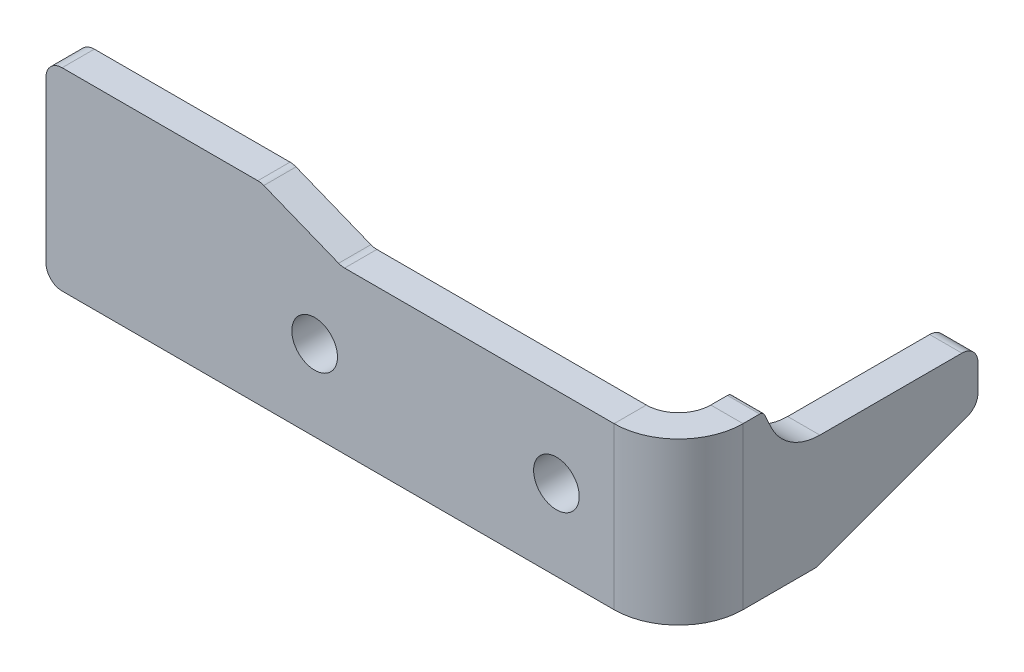
from build123d import *

# Parameters (mm, degrees)
SKETCH1_R                = 4.25
EXTRUDE1_DEPTH           = 6
PROCESS_BENDS1_START     = -45.500357344
PROCESS_BENDS1_OUTLINE_W = 30
PROCESS_BENDS1_OUTLINE_H = 6
PROCESS_BENDS1_DEPTH     = 45.500357344
PROCESS_BENDS1_START_2   = -50.267477344
PROCESS_BENDS1_2_DEPTH   = 4.83288
PROCESS_BENDS1_START_3   = -56.267477344
PROCESS_BENDS1_3_DEPTH   = 6
PROCESS_BENDS1_START_4   = -45.434597344
PROCESS_BENDS1_4_DEPTH   = 1.16712
PROCESS_BENDS1_START_5   = -21
PROCESS_BENDS1_5_DEPTH   = 30


with BuildPart() as part:
    # Sketch1 → Extrude1 (new body)
    with BuildSketch(Plane.XY):
        with BuildLine():
            Line((-106.422252789, 9), (-40.637070261, 9))
            ThreePointArc((-40.637070261, 9), (-40.099770652, 8.843391446), (-39.730762474, 8.422618262))
            Line((-39.730762474, 8.422618262), (-38.495606339, 5.773817383))
            ThreePointArc((-38.495606339, 5.773817383), (-34.805524552, 1.566085542), (-29.432528469, 0))
            Line((-29.432528469, 0), (-3, 0))
            ThreePointArc((-3, 0), (-0.878679656, -0.878679656), (0, -3))
            Line((0, -3), (0, -7.904690938))
            ThreePointArc((0, -7.904690938), (-0.540498847, -9.622495956), (-1.967236053, -10.721319886))
            Line((-1.967236053, -10.721319886), (-29.49989713, -20.816628948))
            ThreePointArc((-29.49989713, -20.816628948), (-30.008202711, -20.95380152), (-30.532661077, -21))
            Line((-30.532661077, -21), (-159, -21))
            ThreePointArc((-159, -21), (-161.121320344, -20.121320344), (-162, -18))
            Line((-162, -18), (-162, 12))
            ThreePointArc((-162, 12), (-161.121320344, 14.121320344), (-159, 15))
            Line((-159, 15), (-122.577747211, 15))
            ThreePointArc((-122.577747211, 15), (-122.010424647, 14.94586916), (-121.463575182, 14.785430073))
            Line((-121.463575182, 14.785430073), (-107.536424818, 9.214569927))
            ThreePointArc((-107.536424818, 9.214569927), (-106.989575353, 9.05413084), (-106.422252789, 9))
        make_face()
        with Locations((-67, -6)):
            Circle(SKETCH1_R, mode=Mode.SUBTRACT)
        with Locations((-112, -6)):
            Circle(SKETCH1_R, mode=Mode.SUBTRACT)
    extrude(amount=EXTRUDE1_DEPTH)

    # Process-Bends1: read off the stored shape, not the designer's step
    # Process-Bends1 outline → Process-Bends1 (cut)
    with BuildSketch(Plane.YZ.offset(PROCESS_BENDS1_START)):
        with Locations((-6, 3)):
            Rectangle(PROCESS_BENDS1_OUTLINE_W, PROCESS_BENDS1_OUTLINE_H)
    extrude(amount=PROCESS_BENDS1_DEPTH, mode=Mode.SUBTRACT)

    # Process-Bends1 2 outline → Process-Bends1 2 (add)
    with BuildSketch(Plane.YZ.offset(PROCESS_BENDS1_START_2)):
        with BuildLine():
            Line((5.773817383, -11.236916317), (8.422618262, -10.001760182))
            ThreePointArc((8.422618262, -10.001760182), (8.843391446, -9.632752004), (9, -9.095452395))
            Line((9, -9.095452395), (9, 0))
            Line((9, 0), (-21, 0))
            Line((-21, 0), (-21, -19.199861579))
            ThreePointArc((-21, -19.199861579), (-20.95380152, -19.724319945), (-20.816628948, -20.232625526))
            Line((-20.816628948, -20.232625526), (-10.721319886, -47.765286604))
            ThreePointArc((-10.721319886, -47.765286604), (-9.622495956, -49.192023809), (-7.904690938, -49.732522656))
            Line((-7.904690938, -49.732522656), (-3, -49.732522656))
            ThreePointArc((-3, -49.732522656), (-0.878679656, -48.853843), (0, -46.732522656))
            Line((0, -46.732522656), (0, -20.299994188))
            ThreePointArc((0, -20.299994188), (1.566085542, -14.926998104), (5.773817383, -11.236916317))
        make_face()
    extrude(amount=PROCESS_BENDS1_2_DEPTH)

    # Process-Bends1 3 outline → Process-Bends1 3 (add)
    with BuildSketch(Plane.YZ.offset(PROCESS_BENDS1_START_3)):
        with BuildLine():
            Line((5.773817383, -11.236916317), (8.422618262, -10.001760182))
            ThreePointArc((8.422618262, -10.001760182), (8.843391446, -9.632752004), (9, -9.095452395))
            Line((9, -9.095452395), (9, 0))
            Line((9, 0), (-21, 0))
            Line((-21, 0), (-21, -19.199861579))
            ThreePointArc((-21, -19.199861579), (-20.95380152, -19.724319945), (-20.816628948, -20.232625526))
            Line((-20.816628948, -20.232625526), (-10.721319886, -47.765286604))
            ThreePointArc((-10.721319886, -47.765286604), (-9.622495956, -49.192023809), (-7.904690938, -49.732522656))
            Line((-7.904690938, -49.732522656), (-3, -49.732522656))
            ThreePointArc((-3, -49.732522656), (-0.878679656, -48.853843), (0, -46.732522656))
            Line((0, -46.732522656), (0, -20.299994188))
            ThreePointArc((0, -20.299994188), (1.566085542, -14.926998104), (5.773817383, -11.236916317))
        make_face()
    extrude(amount=PROCESS_BENDS1_3_DEPTH)

    # Process-Bends1 4 outline → Process-Bends1 4 (add)
    with BuildSketch(Plane.YZ.offset(PROCESS_BENDS1_START_4)):
        with BuildLine():
            Line((5.773817383, -11.236916317), (8.422618262, -10.001760182))
            ThreePointArc((8.422618262, -10.001760182), (8.843391446, -9.632752004), (9, -9.095452395))
            Line((9, -9.095452395), (9, 0))
            Line((9, 0), (-21, 0))
            Line((-21, 0), (-21, -19.199861579))
            ThreePointArc((-21, -19.199861579), (-20.95380152, -19.724319945), (-20.816628948, -20.232625526))
            Line((-20.816628948, -20.232625526), (-10.721319886, -47.765286604))
            ThreePointArc((-10.721319886, -47.765286604), (-9.622495956, -49.192023809), (-7.904690938, -49.732522656))
            Line((-7.904690938, -49.732522656), (-3, -49.732522656))
            ThreePointArc((-3, -49.732522656), (-0.878679656, -48.853843), (0, -46.732522656))
            Line((0, -46.732522656), (0, -20.299994188))
            ThreePointArc((0, -20.299994188), (1.566085542, -14.926998104), (5.773817383, -11.236916317))
        make_face()
    extrude(amount=PROCESS_BENDS1_4_DEPTH)

    # Process-Bends1 5 outline → Process-Bends1 5 (cut)
    with BuildSketch(Plane(origin=(0, 0, 0), x_dir=(1, 0, 0), z_dir=(0, 1, 0)).offset(PROCESS_BENDS1_START_5)):
        with BuildLine():
            Line((-50.267477344, 6), (-50.267477344, 49.732522656))
            Line((-50.267477344, 49.732522656), (-56.267477344, 49.732522656))
            Line((-56.267477344, 49.732522656), (-56.267477344, 0))
            ThreePointArc((-56.267477344, 0), (-52.024836657, 1.757359313), (-50.267477344, 6))
        make_face()
        with BuildLine():
            Line((-44.267477344, 0), (-44.267477344, 6))
            ThreePointArc((-44.267477344, 6), (-47.78219597, -2.485281374), (-56.267477344, -6))
            Line((-56.267477344, -6), (-45.500357344, -6))
            Line((-45.500357344, -6), (-45.500357344, 0))
            Line((-45.500357344, 0), (-44.267477344, 0))
        make_face()
    extrude(amount=PROCESS_BENDS1_5_DEPTH, mode=Mode.SUBTRACT)


solid = part.part
